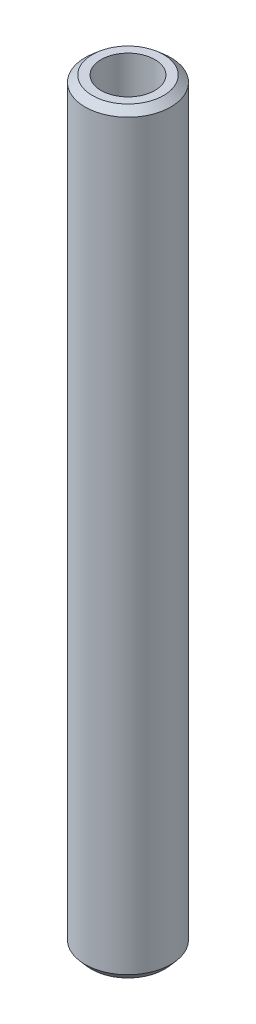
from build123d import *
from OCP.BRepFilletAPI import BRepFilletAPI_MakeChamfer

# Parameters (mm, degrees)
SKETCH1_R           = 17.5
BOSS_EXTRUDE1_DEPTH = 308.86510702
SKETCH2_R           = 10.966587363
CUT_EXTRUDE1_DEPTH  = 310.85505375
CHAMFER1_SIZE       = 2.576020621
CHAMFER1_SIZE2      = 2.979923634


with BuildPart() as part:
    # Sketch1 → Boss-Extrude1 (new body)
    with BuildSketch(Plane(origin=(0, 0, 0), x_dir=(1, 0, 0), z_dir=(0, 1, 0))):
        Circle(SKETCH1_R)
    extrude(amount=BOSS_EXTRUDE1_DEPTH)

    # Sketch2 → Cut-Extrude1 (cut, through all)
    with BuildSketch(Plane(origin=(0, 0, 0), x_dir=(1, 0, 0), z_dir=(0, 1, 0))):
        Circle(SKETCH2_R)
    extrude(amount=CUT_EXTRUDE1_DEPTH, mode=Mode.SUBTRACT)

    # Chamfer1: one chamfer whose edges measure the first distance from different faces: ONE call of the kernel's chamfer builder (chamfer() names one face for all edges)
    chamfer1_edges_1 = [part.edges().sort_by_distance(p)[0] for p in [
        (-17.5, 308.86510702, 0),
    ]]
    chamfer1_side_1 = [part.faces().sort_by_distance(p)[0] for p in [
        (-17.5, 154.43255351, 0),
    ]]
    chamfer1_edges_2 = [part.edges().sort_by_distance(p)[0] for p in [
        (-17.5, 0, 0),
    ]]
    chamfer1_side_2 = [part.faces().sort_by_distance(p)[0] for p in [
        (-17.005025253, 0, 0),
    ]]
    chamfer1 = BRepFilletAPI_MakeChamfer(part.part.solid().wrapped)
    for e in chamfer1_edges_1:
        chamfer1.Add(CHAMFER1_SIZE, CHAMFER1_SIZE2, e.wrapped, chamfer1_side_1[0].wrapped)  # the first distance lies on this face
    for e in chamfer1_edges_2:
        chamfer1.Add(CHAMFER1_SIZE, CHAMFER1_SIZE2, e.wrapped, chamfer1_side_2[0].wrapped)  # the first distance lies on this face
    add(Compound.cast(chamfer1.Shape()), mode=Mode.REPLACE)


solid = part.part
